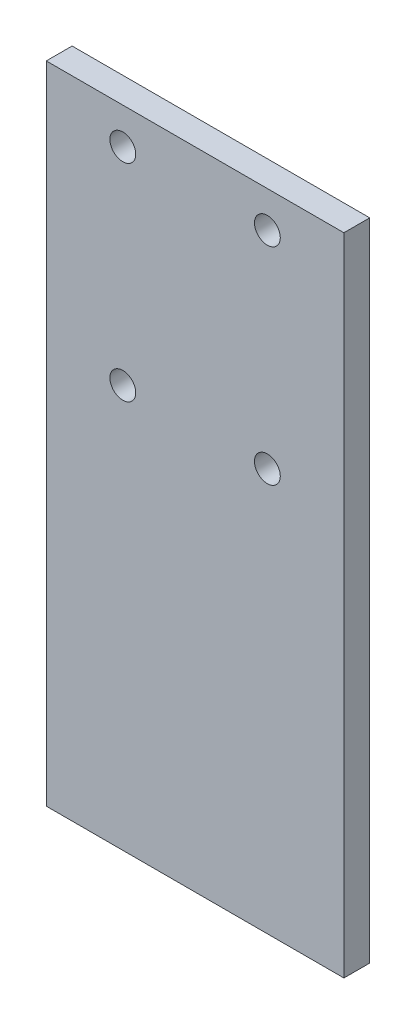
from build123d import *

# Parameters (mm, degrees)
SKETCH_1_W          = 57.64
SKETCH_1_H          = 125
EXTRUDE_1_DEPTH     = 5
SKETCH_2_R          = 2.5
CUT_EXTRUDE_1_DEPTH = 5


with BuildPart() as part:
    # 스케치1 → 보스-돌출1 (new body)
    with BuildSketch(Plane.XY):
        Rectangle(SKETCH_1_W, SKETCH_1_H)
    extrude(amount=EXTRUDE_1_DEPTH)

    # 스케치2 → 컷-돌출1 (cut)
    with BuildSketch(Plane.XY.offset(5)):
        with Locations((-14, 55.5)):
            Circle(SKETCH_2_R)
        with Locations((14, 55.5)):
            Circle(SKETCH_2_R)
        with Locations((-14, 15.5)):
            Circle(SKETCH_2_R)
        with Locations((14, 15.5)):
            Circle(SKETCH_2_R)
    extrude(amount=-CUT_EXTRUDE_1_DEPTH, mode=Mode.SUBTRACT)


solid = part.part
